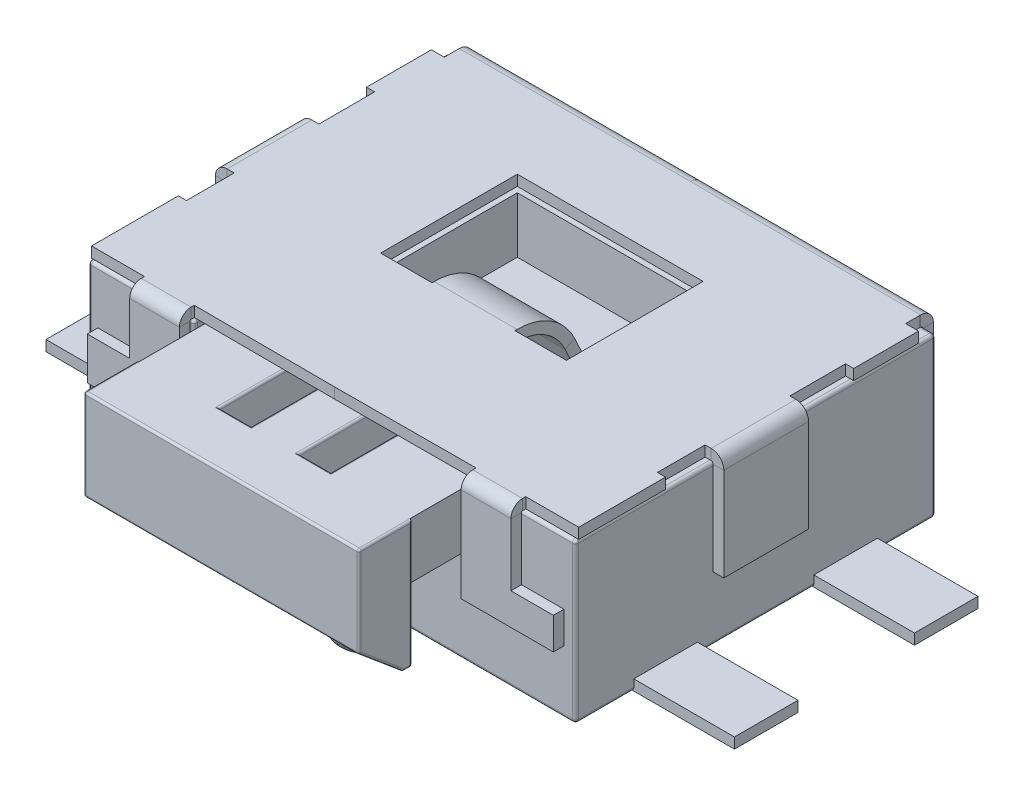
from build123d import *

# Parameters (mm, degrees)
SKETCH_1_W                = 4.6
SKETCH_1_H                = 3.4
EXTRUDE_899_DEPTH         = 1.5
SKETCH_4_R                = 0.3
EXTRUDE_1089_DEPTH        = 0.61
SKETCH_6_W                = 1
SKETCH_6_H                = 0.6
PIN_DEPTH                 = 0.1
PIN_2_DEPTH               = 0.1
PIN_3_DEPTH               = 0.1
PIN_4_DEPTH               = 0.1
SKETCH_7_W                = 1.754012324
SKETCH_7_H                = 1.290778434
CUT_EXTRUDE_1_DEPTH       = 0.5
SKETCH_8_W                = 2.6
SKETCH_8_H                = 0.6
CUT_EXTRUDE_2_DEPTH       = 3
FILLET_1_R                = 0.03
FILLET_2_SIZE             = 0.25
SKETCH_9_W                = 2.563117322
SKETCH_9_H                = 0.526991352
EXTRUDE_1_DEPTH           = 3.5
SKETCH_11_W               = 0.5
SKETCH_11_H               = 1.2
EXTRUDE_2_DEPTH           = 1.3
SKETCH_12_W               = 0.3
SKETCH_12_H               = 1.630126151
SKETCH_12_W_2             = 1.754012324
SKETCH_12_H_2             = 1.290778434
CUT_EXTRUDE_3_DEPTH       = 0.54769
SM_BASE_FLANGE_4557_DEPTH = 0.1
CUT_EXTRUDE_3_2_DEPTH     = 0.1
SM_EDGE_FLANGE_1_DEPTH    = 0.47
SM_EDGE_FLANGE_2_DEPTH    = 0.47
SM_START                  = -0.4
SM_EDGE_FLANGE_3_DEPTH    = 0.8
SM_START_2                = -0.003844813
SM_EDGE_FLANGE_4_DEPTH    = 2.178259273
SM_START_3                = -2.17441446
SM_EDGE_FLANGE_5_DEPTH    = 2.178259273
SM_EDGE_FLANGE_6_DEPTH    = 0.8
SM_START_4                = -0.391342618
SM_EDGE_FLANGE_7_DEPTH    = 0.782685236
SKETCH_44_W               = 0.1
SKETCH_44_H               = 0.3
EXTRUDE_3_DEPTH           = 0.4
SKETCH_45_W               = 0.1
SKETCH_45_H               = 0.4
EXTRUDE_4_DEPTH           = 0.4
CHAMFER_2_SIZE            = 0.35
CHAMFER_2_SIZE2           = 0.417113757
FILLET_3_R                = 0.02
FILLET_4_R                = 0.02


with BuildPart() as part:
    # Sketch 1 → Extrude 899 (new body)
    with BuildSketch(Plane(origin=(0, 0, 0), x_dir=(1, 0, 0), z_dir=(0, 1, 0))):
        Rectangle(SKETCH_1_W, SKETCH_1_H)
    extrude(amount=EXTRUDE_899_DEPTH)

    # 草图4 → Extrude 1089 (add)
    with BuildSketch(Plane(origin=(0, 0, 0), x_dir=(-1, 0, 0), z_dir=(0, -1, 0))):
        with Locations(Location((0, -1.375, 0), (0, 0, 90))):
            Circle(SKETCH_4_R)
        with Locations(Location((0, 1.375, 0), (0, 0, 90))):
            Circle(SKETCH_4_R)
    extrude(amount=EXTRUDE_1089_DEPTH)

    # 草图7 → 龟形按键黑色本体切除1 (cut)
    with BuildSketch(Plane(origin=(0, 1.5, 0), x_dir=(1, 0, 0), z_dir=(0, 1, 0))):
        with Locations((0, 0.281784945)):
            Rectangle(SKETCH_7_W, SKETCH_7_H)
    extrude(amount=-CUT_EXTRUDE_1_DEPTH, mode=Mode.SUBTRACT)

    # 草图8 → 龟形按键黑色本体切除2 (cut)
    with BuildSketch(Plane.XY.offset(1.7)):
        with Locations((0, 1.2)):
            Rectangle(SKETCH_8_W, SKETCH_8_H)
    extrude(amount=-CUT_EXTRUDE_2_DEPTH, mode=Mode.SUBTRACT)

    # 圆角1
    fillet_1_edges = [part.edges().sort_by_distance(p)[0] for p in [
        (0, 1.5, -1.7),
        (-2.3, 1.5, 0),
        (1.8, 1.5, 1.7),
        (0, 1.5, -1.3),
        (-1.3, 1.5, 0.2),
        (1.3, 1.5, 0.2),
        (-1.3, 1.2, 1.7),
        (0, 0.9, 1.7),
        (1.3, 1.2, 1.7),
        (-1.8, 1.5, 1.7),
        (-2.3, 0, 0),
        (0, 0, -1.7),
        (2.3, 0, 0),
        (0, 0, 1.7),
        (-2.3, 0.75, 1.7),
        (-2.3, 0.75, -1.7),
        (2.3, 0.75, -1.7),
        (2.3, 0.75, 1.7),
        (2.3, 1.5, 0),
    ]]
    fillet(fillet_1_edges, radius=FILLET_1_R)

    # 圆角2
    # a fillet whose section is not a circle: 0.25 mm, written as the material it takes off along each edge
    with BuildSketch(Plane(origin=(0, -0.61, 1.375), x_dir=(0, 0, -1), z_dir=(-1, 0, 0))) as fillet_2_piece_1:
        with BuildLine():
            add(Edge.make_bspline([(0.3, -FILLET_2_SIZE), (0.3, -FILLET_2_SIZE * 0.831801948466), (0.3, -FILLET_2_SIZE * 0.663603896932), (0.3 - FILLET_2_SIZE * 0.0716919198361, -FILLET_2_SIZE * 0.292893218813), (0.3 - FILLET_2_SIZE * 0.292893218813, -FILLET_2_SIZE * 0.0716919198361), (0.3 - FILLET_2_SIZE * 0.663603896932, 0), (0.3 - FILLET_2_SIZE * 0.831801948466, 0), (0.3 - FILLET_2_SIZE, 0)], knots=[0, 0, 0, 0, 0, 0, 0.5, 0.5, 1, 1, 1, 1, 1, 1], degree=5))
            Line((0.3 - FILLET_2_SIZE, 0), (0.3, 0))
            Line((0.3, 0), (0.3, -FILLET_2_SIZE))
        make_face()
    revolve(axis=Axis((0, -0.61, 1.375), (0, -1, 0)), mode=Mode.SUBTRACT)
    with BuildSketch(Plane(origin=(0, -0.61, -1.375), x_dir=(0, 0, -1), z_dir=(-1, 0, 0))) as fillet_2_piece_2:
        with BuildLine():
            add(Edge.make_bspline([(0.3, -FILLET_2_SIZE), (0.3, -FILLET_2_SIZE * 0.831801948466), (0.3, -FILLET_2_SIZE * 0.663603896932), (0.3 - FILLET_2_SIZE * 0.0716919198361, -FILLET_2_SIZE * 0.292893218813), (0.3 - FILLET_2_SIZE * 0.292893218813, -FILLET_2_SIZE * 0.0716919198361), (0.3 - FILLET_2_SIZE * 0.663603896932, 0), (0.3 - FILLET_2_SIZE * 0.831801948466, 0), (0.3 - FILLET_2_SIZE, 0)], knots=[0, 0, 0, 0, 0, 0, 0.5, 0.5, 1, 1, 1, 1, 1, 1], degree=5))
            Line((0.3 - FILLET_2_SIZE, 0), (0.3, 0))
            Line((0.3, 0), (0.3, -FILLET_2_SIZE))
        make_face()
    revolve(axis=Axis((0, -0.61, -1.375), (0, -1, 0)), mode=Mode.SUBTRACT)



with BuildPart() as body_2:
    # 草图6 → pin (new body)
    with BuildSketch(Plane.XZ):
        with Locations((2.75, 0.85)):
            Rectangle(SKETCH_6_W, SKETCH_6_H)
    extrude(amount=-PIN_DEPTH)


with BuildPart() as body_3:
    # 草图6 → pin 2 (new body)
    with BuildSketch(Plane.XZ):
        with Locations((-2.75, 0.85)):
            Rectangle(SKETCH_6_W, SKETCH_6_H)
    extrude(amount=-PIN_2_DEPTH)


with BuildPart() as body_4:
    # 草图6 → pin 3 (new body)
    with BuildSketch(Plane.XZ):
        with Locations((2.75, -0.85)):
            Rectangle(SKETCH_6_W, SKETCH_6_H)
    extrude(amount=-PIN_3_DEPTH)


with BuildPart() as body_5:
    # 草图6 → pin 4 (new body)
    with BuildSketch(Plane.XZ):
        with Locations((-2.75, -0.85)):
            Rectangle(SKETCH_6_W, SKETCH_6_H)
    extrude(amount=-PIN_4_DEPTH)


with BuildPart() as body_6:
    # 草图9 → 龟形按键按钮拉伸1 (new body)
    with BuildSketch(Plane.XY.offset(-1.256)):
        with Locations((0, 1.184194539)):
            Rectangle(SKETCH_9_W, SKETCH_9_H)
    extrude(amount=EXTRUDE_1_DEPTH)

    # 草图11 → 龟形按键按钮拉伸2 (add, symmetric)
    with BuildSketch(Plane(origin=(0, 0, 0), x_dir=(0, 0, -1), z_dir=(1, 0, 0))):
        with Locations((-2.494, 0.847690215)):
            Rectangle(SKETCH_11_W, SKETCH_11_H)
    extrude(amount=EXTRUDE_2_DEPTH, both=True)

    # 草图12 → Cut-Extrude 3 (cut)
    with BuildSketch(Plane(origin=(0, 1.447690215, 0), x_dir=(1, 0, 0), z_dir=(0, 1, 0))):
        with Locations((-0.376248466, -1.420642753)):
            Rectangle(SKETCH_12_W, SKETCH_12_H)
        with Locations((0, 0.281784945)):
            Rectangle(SKETCH_12_W_2, SKETCH_12_H_2)
        with Locations((0.376248466, -1.420642753)):
            Rectangle(SKETCH_12_W, SKETCH_12_H)
    extrude(amount=-CUT_EXTRUDE_3_DEPTH, mode=Mode.SUBTRACT)

    # 倒角2
    chamfer_2_edges = [body_6.edges().sort_by_distance(p)[0] for p in [
        (0, 0.247690215, 2.744),
    ]]
    chamfer_2_side = [body_6.faces().sort_by_distance(p)[0] for p in [
        (0, 0.847690215, 2.744),
    ]]
    chamfer(chamfer_2_edges, length=CHAMFER_2_SIZE, length2=CHAMFER_2_SIZE2, reference=chamfer_2_side[0])

    # 圆角3
    fillet_3_edges = [body_6.edges().sort_by_distance(p)[0] for p in [
        (0, 0.247690215, 2.244),
        (-1.3, 0.247690215, 2.285443121),
        (0, 0.247690215, 2.326886243),
        (1.3, 0.247690215, 2.285443121),
        (-1.3, 0.847690215, 2.244),
        (-1.3, 0.422690215, 2.535443121),
        (-1.3, 1.022690215, 2.744),
        (1.3, 0.847690215, 2.244),
        (0, 0.597690215, 2.744),
        (1.3, 0.422690215, 2.535443121),
        (1.3, 1.022690215, 2.744),
        (0, 1.447690215, 2.744),
    ]]
    fillet(fillet_3_edges, radius=FILLET_3_R)

    # 圆角4
    # the kernel refuses this fillet: 0.02 mm, written as the material it takes off along each edge
    with BuildSketch(Plane(origin=(-1.28, 1.427690215, 2.724), x_dir=(0, 1, 0), z_dir=(-1, 0, 0))) as fillet_4_piece_1_section:
        Polygon((0, 0), (FILLET_4_R * 1.02, 0), (FILLET_4_R * 1.02, -FILLET_4_R * 1.02), (0, -FILLET_4_R * 1.02), align=None)
    fillet_4_piece_1 = extrude(amount=FILLET_4_R * 1.02, mode=Mode.PRIVATE)
    fillet_4_piece_1 = fillet_4_piece_1 - Plane(origin=(-1.28, 1.427690215, 2.724), x_dir=(0, -0.7071067811865475, -0.7071067811865475), z_dir=(-1, 0, 0)) * Sphere(FILLET_4_R, mode=Mode.PRIVATE)
    add(fillet_4_piece_1, mode=Mode.SUBTRACT)
    with BuildSketch(Plane(origin=(1.28, 1.427690215, 2.724), x_dir=(1, 0, 0), z_dir=(0, 1, 0))) as fillet_4_piece_2_section:
        Polygon((0, 0), (FILLET_4_R * 1.02, 0), (FILLET_4_R * 1.02, -FILLET_4_R * 1.02), (0, -FILLET_4_R * 1.02), align=None)
    fillet_4_piece_2 = extrude(amount=FILLET_4_R * 1.02, mode=Mode.PRIVATE)
    fillet_4_piece_2 = fillet_4_piece_2 - Plane(origin=(1.28, 1.427690215, 2.724), x_dir=(-0.7071067811865475, 0, -0.7071067811865475), z_dir=(0, 1, 0)) * Sphere(FILLET_4_R, mode=Mode.PRIVATE)
    add(fillet_4_piece_2, mode=Mode.SUBTRACT)
    with BuildSketch(Plane(origin=(0.526248466, 1.447690215, 0.605579677), x_dir=(1, 0, 0), z_dir=(0, 0, 1)), Plane(origin=(0.226248466, 1.447690215, 2.235705828), x_dir=(-1, 0, 0), z_dir=(0, 0, -1)), Plane(origin=(-0.226248466, 1.447690215, 0.605579677), x_dir=(1, 0, 0), z_dir=(0, 0, 1)), Plane(origin=(-0.526248466, 1.447690215, 2.235705828), x_dir=(-1, 0, 0), z_dir=(0, 0, -1))) as fillet_4_piece_3:
        with BuildLine():
            CenterArc((FILLET_4_R, -FILLET_4_R), FILLET_4_R, 90, 90)
            Line((0, -FILLET_4_R), (0, 0))
            Line((0, 0), (FILLET_4_R, 0))
        make_face()
    extrude(amount=1.630126151, mode=Mode.SUBTRACT)
    with BuildSketch(Plane(origin=(0.526248466, 1.447690215, 2.235705828), x_dir=(0, 0, 1), z_dir=(-1, 0, 0)), Plane(origin=(-0.226248466, 1.447690215, 2.235705828), x_dir=(0, 0, 1), z_dir=(-1, 0, 0))) as fillet_4_piece_4:
        with BuildLine():
            CenterArc((FILLET_4_R, -FILLET_4_R), FILLET_4_R, 90, 90)
            Line((0, -FILLET_4_R), (0, 0))
            Line((0, 0), (FILLET_4_R, 0))
        make_face()
    extrude(amount=0.3, mode=Mode.SUBTRACT)
    with BuildSketch(Plane(origin=(-1.3, 1.447690215, 2.214), x_dir=(0, -1, 0), z_dir=(0, 0, 1)), Plane(origin=(1.3, 1.447690215, 2.214), x_dir=(-1, 0, 0), z_dir=(0, 0, 1))) as fillet_4_piece_5:
        with BuildLine():
            CenterArc((FILLET_4_R, FILLET_4_R), FILLET_4_R, 180, 90)
            Line((0, FILLET_4_R), (0, 0))
            Line((0, 0), (FILLET_4_R, 0))
        make_face()
    extrude(amount=0.51, mode=Mode.SUBTRACT)
    with BuildSketch(Plane(origin=(0.576248466, 1.447690215, 2.235705828), x_dir=(0, 0, 1), z_dir=(-1, 0, 0))) as fillet_4_piece_6a_section:
        with BuildLine():
            CenterArc((FILLET_4_R, -FILLET_4_R), FILLET_4_R, 90, 90)
            Line((0, -FILLET_4_R), (0, 0))
            Line((0, 0), (FILLET_4_R, 0))
        make_face()
    fillet_4_piece_6a = extrude(amount=0.35, mode=Mode.PRIVATE)
    fillet_4_piece_6a = split(fillet_4_piece_6a, bisect_by=Plane(origin=(0.526248466, 1.447690215, 2.235705828), z_dir=(1, 0, 0)), keep=Keep.TOP, mode=Mode.PRIVATE)
    with BuildSketch(Plane(origin=(0.526248466, 1.447690215, 0.605579677), x_dir=(1, 0, 0), z_dir=(0, 0, 1))) as fillet_4_piece_6b_section:
        with BuildLine():
            CenterArc((FILLET_4_R, -FILLET_4_R), FILLET_4_R, 90, 90)
            Line((0, -FILLET_4_R), (0, 0))
            Line((0, 0), (FILLET_4_R, 0))
        make_face()
    fillet_4_piece_6b = extrude(amount=1.680126151, mode=Mode.PRIVATE)
    fillet_4_piece_6b = split(fillet_4_piece_6b, bisect_by=Plane(origin=(0.526248466, 1.447690215, 2.235705828), z_dir=(0, 0, 1)), keep=Keep.TOP, mode=Mode.PRIVATE)
    fillet_4_piece_6 = fillet_4_piece_6a & fillet_4_piece_6b
    add(fillet_4_piece_6, mode=Mode.SUBTRACT)
    with BuildSketch(Plane(origin=(0.226248466, 1.447690215, 2.285705828), x_dir=(-1, 0, 0), z_dir=(0, 0, -1))) as fillet_4_piece_7a_section:
        with BuildLine():
            CenterArc((FILLET_4_R, -FILLET_4_R), FILLET_4_R, 90, 90)
            Line((0, -FILLET_4_R), (0, 0))
            Line((0, 0), (FILLET_4_R, 0))
        make_face()
    fillet_4_piece_7a = extrude(amount=1.680126151, mode=Mode.PRIVATE)
    fillet_4_piece_7a = split(fillet_4_piece_7a, bisect_by=Plane(origin=(0.226248466, 1.447690215, 2.235705828), z_dir=(0, 0, 1)), keep=Keep.TOP, mode=Mode.PRIVATE)
    with BuildSketch(Plane(origin=(0.526248466, 1.447690215, 2.235705828), x_dir=(0, 0, 1), z_dir=(-1, 0, 0))) as fillet_4_piece_7b_section:
        with BuildLine():
            CenterArc((FILLET_4_R, -FILLET_4_R), FILLET_4_R, 90, 90)
            Line((0, -FILLET_4_R), (0, 0))
            Line((0, 0), (FILLET_4_R, 0))
        make_face()
    fillet_4_piece_7b = extrude(amount=0.35, mode=Mode.PRIVATE)
    fillet_4_piece_7b = split(fillet_4_piece_7b, bisect_by=Plane(origin=(0.226248466, 1.447690215, 2.235705828), z_dir=(-1, 0, 0)), keep=Keep.TOP, mode=Mode.PRIVATE)
    fillet_4_piece_7 = fillet_4_piece_7a & fillet_4_piece_7b
    add(fillet_4_piece_7, mode=Mode.SUBTRACT)
    with BuildSketch(Plane(origin=(-0.226248466, 1.447690215, 0.605579677), x_dir=(1, 0, 0), z_dir=(0, 0, 1))) as fillet_4_piece_8a_section:
        with BuildLine():
            CenterArc((FILLET_4_R, -FILLET_4_R), FILLET_4_R, 90, 90)
            Line((0, -FILLET_4_R), (0, 0))
            Line((0, 0), (FILLET_4_R, 0))
        make_face()
    fillet_4_piece_8a = extrude(amount=1.680126151, mode=Mode.PRIVATE)
    fillet_4_piece_8a = split(fillet_4_piece_8a, bisect_by=Plane(origin=(-0.226248466, 1.447690215, 2.235705828), z_dir=(0, 0, 1)), keep=Keep.TOP, mode=Mode.PRIVATE)
    with BuildSketch(Plane(origin=(-0.176248466, 1.447690215, 2.235705828), x_dir=(0, 0, 1), z_dir=(-1, 0, 0))) as fillet_4_piece_8b_section:
        with BuildLine():
            CenterArc((FILLET_4_R, -FILLET_4_R), FILLET_4_R, 90, 90)
            Line((0, -FILLET_4_R), (0, 0))
            Line((0, 0), (FILLET_4_R, 0))
        make_face()
    fillet_4_piece_8b = extrude(amount=0.35, mode=Mode.PRIVATE)
    fillet_4_piece_8b = split(fillet_4_piece_8b, bisect_by=Plane(origin=(-0.226248466, 1.447690215, 2.235705828), z_dir=(1, 0, 0)), keep=Keep.TOP, mode=Mode.PRIVATE)
    fillet_4_piece_8 = fillet_4_piece_8a & fillet_4_piece_8b
    add(fillet_4_piece_8, mode=Mode.SUBTRACT)
    with BuildSketch(Plane(origin=(-0.526248466, 1.447690215, 2.285705828), x_dir=(-1, 0, 0), z_dir=(0, 0, -1))) as fillet_4_piece_9a_section:
        with BuildLine():
            CenterArc((FILLET_4_R, -FILLET_4_R), FILLET_4_R, 90, 90)
            Line((0, -FILLET_4_R), (0, 0))
            Line((0, 0), (FILLET_4_R, 0))
        make_face()
    fillet_4_piece_9a = extrude(amount=1.680126151, mode=Mode.PRIVATE)
    fillet_4_piece_9a = split(fillet_4_piece_9a, bisect_by=Plane(origin=(-0.526248466, 1.447690215, 2.235705828), z_dir=(0, 0, 1)), keep=Keep.TOP, mode=Mode.PRIVATE)
    with BuildSketch(Plane(origin=(-0.226248466, 1.447690215, 2.235705828), x_dir=(0, 0, 1), z_dir=(-1, 0, 0))) as fillet_4_piece_9b_section:
        with BuildLine():
            CenterArc((FILLET_4_R, -FILLET_4_R), FILLET_4_R, 90, 90)
            Line((0, -FILLET_4_R), (0, 0))
            Line((0, 0), (FILLET_4_R, 0))
        make_face()
    fillet_4_piece_9b = extrude(amount=0.35, mode=Mode.PRIVATE)
    fillet_4_piece_9b = split(fillet_4_piece_9b, bisect_by=Plane(origin=(-0.526248466, 1.447690215, 2.235705828), z_dir=(-1, 0, 0)), keep=Keep.TOP, mode=Mode.PRIVATE)
    fillet_4_piece_9 = fillet_4_piece_9a & fillet_4_piece_9b
    add(fillet_4_piece_9, mode=Mode.SUBTRACT)


with BuildPart() as body_7:
    # Sm Base Flange 4557: sheet metal written as solids
    # 草图13 → Sm Base Flange 4557 (new body)
    with BuildSketch(Plane(origin=(0, 1.5, 0), x_dir=(1, 0, 0), z_dir=(0, 1, 0))):
        Polygon((2.3, -0.85), (2.3, -1.67), (1.8, -1.67), (1.8, -1.7), (1.33, -1.7), (1.33, -1.67), (0, -1.675), (-1.33, -1.67), (-1.33, -1.7), (-1.8, -1.7), (-1.8, -1.67), (-2.3, -1.67), (-2.3, -0.85), (-2.223363378, -0.85), (-2.223363378, -0.4), (-2.27, -0.4), (-2.27, 0.4), (-2.223363378, 0.4), (-2.223363378, 0.926113351), (-2.3, 0.926113351), (-2.3, 1.538855395), (-2.178253534, 1.538855395), (-2.178253534, 1.67), (0, 1.675), (2.178253534, 1.67), (2.178253534, 1.538855395), (2.3, 1.538855395), (2.3, 0.926113351), (2.223363378, 0.926113351), (2.223363378, 0.4), (2.27, 0.4), (2.27, -0.4), (2.223363378, -0.4), (2.223363378, -0.85), align=None)
    extrude(amount=SM_BASE_FLANGE_4557_DEPTH)

    # 草图21 → Cut-Extrude 3 2 (cut)
    with BuildSketch(Plane(origin=(0, 1.6, 0), x_dir=(1, 0, 0), z_dir=(0, 1, 0))):
        Polygon((-0.877006162, 0.927174162), (0.877006162, 0.927174162), (0.877006162, -0.363604272), (0.391342618, -0.363604272), (0.391342618, -0.343403437), (-0.391342618, -0.343403437), (-0.391342618, -0.363604272), (-0.877006162, -0.363604272), align=None)
    extrude(amount=-CUT_EXTRUDE_3_2_DEPTH, mode=Mode.SUBTRACT)

    # 边线-法兰1: sheet metal written as solids
    # 边线-法兰1 section (on a plane across the edge) → 边线-法兰1 (add)
    with BuildSketch(Plane(origin=(-1.33, 1.5, 1.71), x_dir=(0, 0, -1), z_dir=(-1, 0, 0))):
        with BuildLine():
            Line((-0.1, 0.01), (-0.1, 0.9))
            Line((-0.1, 0.9), (0, 0.9))
            Line((0, 0.9), (0, 0.01))
            ThreePointArc((0, 0.01), (0.002928932, 0.002928932), (0.01, 0))
            Line((0.01, 0), (0.01, -0.1))
            ThreePointArc((0.01, -0.1), (-0.067781746, -0.067781746), (-0.1, 0.01))
        make_face()
    extrude(amount=SM_EDGE_FLANGE_1_DEPTH)

    # 边线-法兰2: sheet metal written as solids
    # 边线-法兰2 section (on a plane across the edge) → 边线-法兰2 (add)
    with BuildSketch(Plane(origin=(1.8, 1.5, 1.71), x_dir=(0, 0, -1), z_dir=(-1, 0, 0))):
        with BuildLine():
            Line((-0.1, 0.01), (-0.1, 0.9))
            Line((-0.1, 0.9), (0, 0.9))
            Line((0, 0.9), (0, 0.01))
            ThreePointArc((0, 0.01), (0.002928932, 0.002928932), (0.01, 0))
            Line((0.01, 0), (0.01, -0.1))
            ThreePointArc((0.01, -0.1), (-0.067781746, -0.067781746), (-0.1, 0.01))
        make_face()
    extrude(amount=SM_EDGE_FLANGE_2_DEPTH)

    # 边线-法兰3: read off the stored shape, not the designer's step
    # 边线-法兰3 outline → 边线-法兰3 (add)
    with BuildSketch(Plane.XY.offset(SM_START)):
        with BuildLine():
            Line((-2.4, 1.49), (-2.4, 0.6))
            Line((-2.4, 0.6), (-2.3, 0.6))
            Line((-2.3, 0.6), (-2.3, 1.49))
            ThreePointArc((-2.3, 1.49), (-2.297071068, 1.497071068), (-2.29, 1.5))
            Line((-2.29, 1.5), (-2.27, 1.5))
            Line((-2.27, 1.5), (-2.27, 1.6))
            Line((-2.27, 1.6), (-2.29, 1.6))
            ThreePointArc((-2.29, 1.6), (-2.367781746, 1.567781746), (-2.4, 1.49))
        make_face()
    extrude(amount=SM_EDGE_FLANGE_3_DEPTH)

    # 边线-法兰4: read off the stored shape, not the designer's step
    # 边线-法兰4 outline → 边线-法兰4 (add)
    with BuildSketch(Plane(origin=(0, 0, 0), x_dir=(0, 1, 0), z_dir=(0.999997365541012, 0, 0.002295410864227)).offset(SM_START_2)):
        with BuildLine():
            Line((1.48, -1.704995587), (0.6, -1.704995587))
            Line((0.6, -1.704995587), (0.6, -1.804995587))
            Line((0.6, -1.804995587), (1.48, -1.804995587))
            ThreePointArc((1.48, -1.804995587), (1.564852814, -1.769848401), (1.6, -1.684995587))
            Line((1.6, -1.684995587), (1.6, -1.674995587))
            Line((1.6, -1.674995587), (1.5, -1.674995587))
            Line((1.5, -1.674995587), (1.5, -1.684995587))
            ThreePointArc((1.5, -1.684995587), (1.494142136, -1.699137723), (1.48, -1.704995587))
        make_face()
    extrude(amount=SM_EDGE_FLANGE_4_DEPTH)

    # 边线-法兰5: read off the stored shape, not the designer's step
    # 边线-法兰5 outline → 边线-法兰5 (add)
    with BuildSketch(Plane(origin=(0, 0, 0), x_dir=(0, 1, 0), z_dir=(0.999997365541012, 0, -0.00229541086423238)).offset(SM_START_3)):
        with BuildLine():
            Line((1.48, -1.704995587), (0.6, -1.704995587))
            Line((0.6, -1.704995587), (0.6, -1.804995587))
            Line((0.6, -1.804995587), (1.48, -1.804995587))
            ThreePointArc((1.48, -1.804995587), (1.564852814, -1.769848401), (1.6, -1.684995587))
            Line((1.6, -1.684995587), (1.6, -1.674995587))
            Line((1.6, -1.674995587), (1.5, -1.674995587))
            Line((1.5, -1.674995587), (1.5, -1.684995587))
            ThreePointArc((1.5, -1.684995587), (1.494142136, -1.699137723), (1.48, -1.704995587))
        make_face()
    extrude(amount=SM_EDGE_FLANGE_5_DEPTH)

    # 边线-法兰6: read off the stored shape, not the designer's step
    # 边线-法兰6 outline → 边线-法兰6 (add)
    with BuildSketch(Plane.XY.offset(SM_START)):
        with BuildLine():
            Line((2.3, 1.48), (2.3, 0.6))
            Line((2.3, 0.6), (2.4, 0.6))
            Line((2.4, 0.6), (2.4, 1.48))
            ThreePointArc((2.4, 1.48), (2.364852814, 1.564852814), (2.28, 1.6))
            Line((2.28, 1.6), (2.27, 1.6))
            Line((2.27, 1.6), (2.27, 1.5))
            Line((2.27, 1.5), (2.28, 1.5))
            ThreePointArc((2.28, 1.5), (2.294142136, 1.494142136), (2.3, 1.48))
        make_face()
    extrude(amount=SM_EDGE_FLANGE_6_DEPTH)

    # 边线-法兰7: read off the stored shape, not the designer's step
    # 边线-法兰7 outline → 边线-法兰7 (add)
    with BuildSketch(Plane.YZ.offset(SM_START_4)):
        with BuildLine():
            Line((1.010899938, -0.313540589), (1.253570957, -0.200381235))
            ThreePointArc((1.253570957, -0.200381235), (1.506034867, 0.021023672), (1.6, 0.343403437))
            Line((1.6, 0.343403437), (1.5, 0.343403437))
            ThreePointArc((1.5, 0.343403437), (1.421695723, 0.074753633), (1.211309131, -0.109750456))
            Line((1.211309131, -0.109750456), (0.968638112, -0.222909811))
            Line((0.968638112, -0.222909811), (1.010899938, -0.313540589))
        make_face()
    extrude(amount=SM_EDGE_FLANGE_7_DEPTH)


with BuildPart() as part_1:
    add(part.part)

    add(body_7.part)  # 凸台-拉伸3 merges body 7
    # 草图44 → 凸台-拉伸3 (add)
    with BuildSketch(Plane(origin=(1.8, 0, 0), x_dir=(0, 0, -1), z_dir=(1, 0, 0))):
        with Locations((-1.76, 0.75)):
            Rectangle(SKETCH_44_W, SKETCH_44_H)
    extrude(amount=EXTRUDE_3_DEPTH)

    # 草图45 → 凸台-拉伸4 (add)
    with BuildSketch(Plane.ZY.offset(1.8)):
        with Locations((1.76, 0.8)):
            Rectangle(SKETCH_45_W, SKETCH_45_H)
    extrude(amount=EXTRUDE_4_DEPTH)


solid = Compound([body_2.part, body_3.part, body_4.part, body_5.part, body_6.part, part_1.part])
